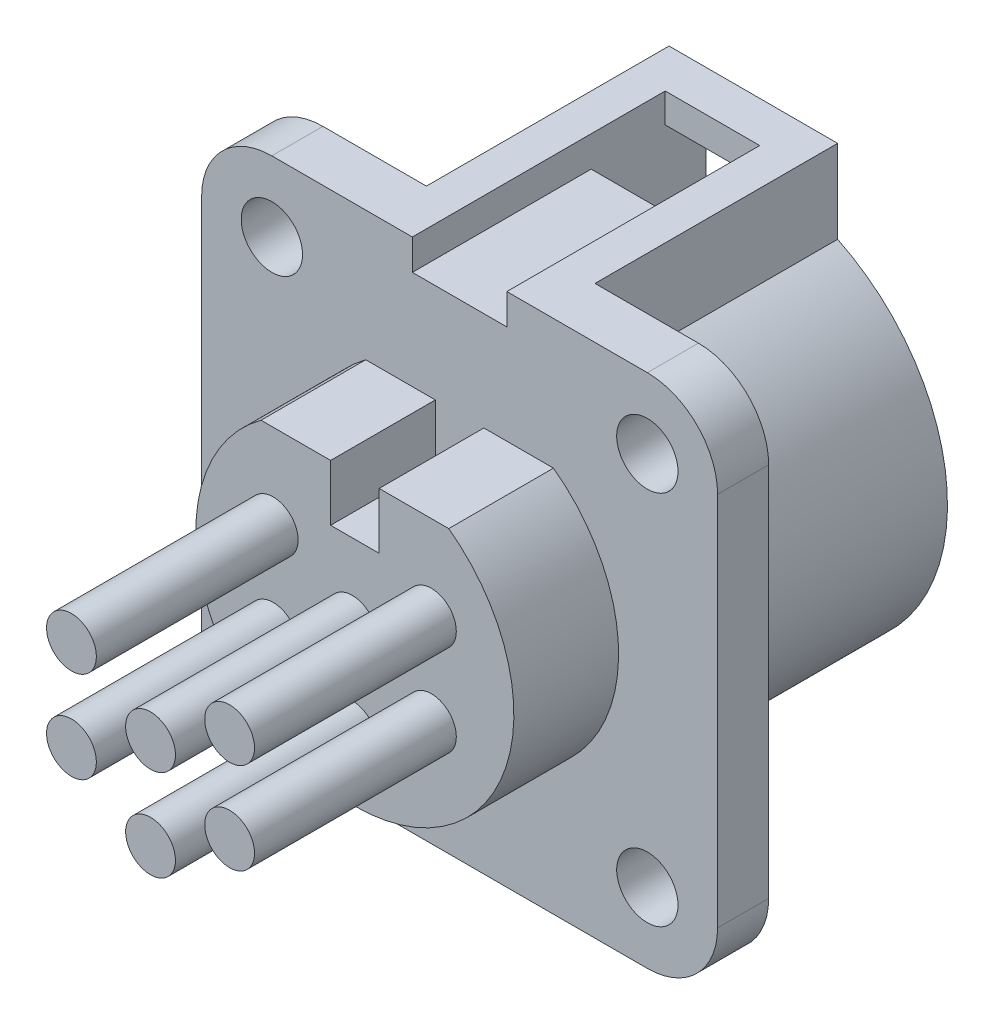
from build123d import *

# Parameters (mm, degrees)
SKICA1_W                     = 20.2
SKICA1_H                     = 20.2
P_IDAT_VYSUNUT_M1_DEPTH      = 2
F_2_4_2_4_PR_M_R_D_RY1_D     = 2.4
F_2_4_2_4_PR_M_R_D_RY1_DEPTH = 25
F_2_4_2_4_PR_M_R_D_RY1_TIP   = 0.721032743
ZAOBLIT1_R                   = 2.75
P_IDAT_VYSUNUT_M2_DEPTH      = 9.5
ODEBRAT_VYSUNUT_M1_DEPTH     = 10
SKICA7_W                     = 3.7
SKICA7_H                     = 1.7
ODEBRAT_VYSUNUT_M2_DEPTH     = 4.5
SKICA8_W                     = 3.7
SKICA8_H                     = 2.4
ODEBRAT_VYSUNUT_M3_DEPTH     = 9.9
P_IDAT_VYSUNUT_M4_DEPTH      = 4.1
P_IDAT_VYSUNUT_M3_DEPTH      = 5.55
P_IDAT_VYSUNUT_M3_DEPTH_BACK = 13.6
SKICA9_R                     = 0.725
ZAOBLIT2_R                   = 0.7
SKICA11_R                    = 0.975
P_IDAT_VYSUNUT_M5_DEPTH      = 7.9


# Read off the part's stored shape, not the designer's step: Skica-pole2
with BuildPart() as part:
    # Skica1 → Přidat vysunutím1 (new body)
    with BuildSketch(Plane.XY):
        Rectangle(SKICA1_W, SKICA1_H)
    extrude(amount=P_IDAT_VYSUNUT_M1_DEPTH)

    # Ø2.4 (2.4) průměr díry1
    with Locations(Plane.XY.offset(2)):
        with Locations((-7.35, 7.35), (7.35, 7.35), (7.35, -7.35), (-7.35, -7.35)):
            Hole(F_2_4_2_4_PR_M_R_D_RY1_D / 2, depth=F_2_4_2_4_PR_M_R_D_RY1_DEPTH)
            with Locations((0, 0, -(F_2_4_2_4_PR_M_R_D_RY1_DEPTH + F_2_4_2_4_PR_M_R_D_RY1_TIP / 2))):  # 118° drill point
                Cone(0, F_2_4_2_4_PR_M_R_D_RY1_D / 2, F_2_4_2_4_PR_M_R_D_RY1_TIP, mode=Mode.SUBTRACT)

    # Zaoblit1
    zaoblit1_edges = [part.edges().sort_by_distance(p)[0] for p in [
        (10.1, -10.1, 1),
        (-10.1, -10.1, 1),
        (-10.1, 10.1, 1),
        (10.1, 10.1, 1),
    ]]
    fillet(zaoblit1_edges, radius=ZAOBLIT1_R)

    # Skica5 → Přidat vysunutím2 (add)
    with BuildSketch(Plane(origin=(0, 0, 0), x_dir=(-1, 0, 0), z_dir=(0, 0, -1))):
        with BuildLine():
            Line((-3.3, 6.846166811), (-3.3, 0))
            Line((-3.3, 0), (3.3, 0))
            Line((3.3, 0), (3.3, 6.846166811))
            ThreePointArc((3.3, 6.846166811), (0, 7.6), (-3.3, 6.846166811))
        make_face()
        with BuildLine():
            Line((3.3, 0), (-3.3, 0))
            Line((-3.3, 0), (-3.3, 6.846166811))
            ThreePointArc((-3.3, 6.846166811), (-4.042276586, -6.435837164), (7.6, 0))
            ThreePointArc((7.6, 0), (6.435837164, 4.042276586), (3.3, 6.846166811))
            Line((3.3, 6.846166811), (3.3, 0))
        make_face()
        with BuildLine():
            Line((-3.3, 10.1), (-3.3, 6.846166811))
            ThreePointArc((-3.3, 6.846166811), (0, 7.6), (3.3, 6.846166811))
            Line((3.3, 6.846166811), (3.3, 10.1))
            Line((3.3, 10.1), (-3.3, 10.1))
        make_face()
    extrude(amount=P_IDAT_VYSUNUT_M2_DEPTH)

    # Skica6 → Odebrat vysunutím1 (cut)
    with BuildSketch(Plane(origin=(0, 0, -9.5), x_dir=(-1, 0, 0), z_dir=(0, 0, -1))):
        with BuildLine():
            Line((1.85, 5.812701609), (1.85, 4.1))
            Line((1.85, 4.1), (-1.85, 4.1))
            Line((-1.85, 4.1), (-1.85, 5.812701609))
            ThreePointArc((-1.85, 5.812701609), (-3.600347205, -4.924175058), (6.1, 0))
            ThreePointArc((6.1, 0), (4.924175058, 3.600347205), (1.85, 5.812701609))
        make_face()
        with BuildLine():
            Line((-1.85, 4.1), (1.85, 4.1))
            Line((1.85, 4.1), (1.85, 5.812701609))
            ThreePointArc((1.85, 5.812701609), (0, 6.1), (-1.85, 5.812701609))
            Line((-1.85, 5.812701609), (-1.85, 4.1))
        make_face()
        with BuildLine():
            ThreePointArc((-1.85, 5.812701609), (0, 6.1), (1.85, 5.812701609))
            Line((1.85, 5.812701609), (1.85, 8.1))
            Line((1.85, 8.1), (-1.85, 8.1))
            Line((-1.85, 8.1), (-1.85, 5.812701609))
        make_face()
    extrude(amount=-ODEBRAT_VYSUNUT_M1_DEPTH, mode=Mode.SUBTRACT)

    # Skica7 → Odebrat vysunutím2 (cut)
    with BuildSketch(Plane(origin=(0, 0, -9.5), x_dir=(-1, 0, 0), z_dir=(0, 0, -1))):
        with Locations((0, 8.1)):
            Rectangle(SKICA7_W, SKICA7_H)
    extrude(amount=-ODEBRAT_VYSUNUT_M2_DEPTH, mode=Mode.SUBTRACT)

    # Skica8 → Odebrat vysunutím3 (cut)
    with BuildSketch(Plane.XY.offset(2)):
        with Locations((0, 10.1)):
            Rectangle(SKICA8_W, SKICA8_H)
    extrude(amount=-ODEBRAT_VYSUNUT_M3_DEPTH, mode=Mode.SUBTRACT)

    # Skica10 → Přidat vysunutím4 (add)
    with BuildSketch(Plane.XY.offset(2)):
        with BuildLine():
            Line((-0.95, 5.025), (-3.674234614, 5.025))
            ThreePointArc((-3.674234614, 5.025), (-2.817668764, -5.550798838), (6.225, 0))
            ThreePointArc((6.225, 0), (5.550798838, 2.817668764), (3.674234614, 5.025))
            Line((3.674234614, 5.025), (0.95, 5.025))
            Line((0.95, 5.025), (0.95, 2.825))
            Line((0.95, 2.825), (-0.95, 2.825))
            Line((-0.95, 2.825), (-0.95, 5.025))
        make_face()
    extrude(amount=P_IDAT_VYSUNUT_M4_DEPTH)


with BuildPart() as body_2:
    # Skica9 → Přidat vysunutím3 (new, two sides: drawn at the far end of the back side and taken through both)
    with BuildSketch(Plane(origin=(0, 0, 0.5), x_dir=(-1, 0, 0), z_dir=(0, 0, -1)).offset(-P_IDAT_VYSUNUT_M3_DEPTH_BACK)):
        with Locations(Location((0, 0, 0), (0, 0, 180))):
            Circle(SKICA9_R)
    extrude(amount=P_IDAT_VYSUNUT_M3_DEPTH + P_IDAT_VYSUNUT_M3_DEPTH_BACK)

    # Zaoblit2
    zaoblit2_edges = [body_2.edges().sort_by_distance(p)[0] for p in [
        (-0.725, 0, -5.05),
    ]]
    fillet(zaoblit2_edges, radius=ZAOBLIT2_R)

    # Skica11 → Přidat vysunutím5 (add)
    with BuildSketch(Plane.XY.offset(14.1)):
        Circle(SKICA11_R)
    extrude(amount=-P_IDAT_VYSUNUT_M5_DEPTH)


with BuildPart() as body_3:
    # Skica-pole2 outline → Skica-pole2 (revolve)
    with BuildSketch(Plane(origin=(3.096040819, 1.7875, 0), x_dir=(1, 0, 0), z_dir=(0, -1, 0))):
        with BuildLine():
            ThreePointArc((0.025, -5.05), (0.519974747, -4.844974747), (0.725, -4.35))
            Line((0.725, -4.35), (0.725, 6.2))
            Line((0.725, 6.2), (0.975, 6.2))
            Line((0.975, 6.2), (0.975, 14.1))
            Line((0.975, 14.1), (0, 14.1))
            Line((0, 14.1), (0, -5.05))
            Line((0, -5.05), (0.025, -5.05))
        make_face()
    revolve(axis=Axis((3.096040819, 1.7875, 0), (0, 0, 1)))


with BuildPart() as body_4:
    # Skica-pole2 2 outline → Skica-pole2 2 (revolve)
    with BuildSketch(Plane(origin=(3.096040819, -1.7875, 0), x_dir=(1, 0, 0), z_dir=(0, -1, 0))):
        with BuildLine():
            Line((0, 14.1), (0, -5.05))
            Line((0, -5.05), (0.025, -5.05))
            ThreePointArc((0.025, -5.05), (0.519974747, -4.844974747), (0.725, -4.35))
            Line((0.725, -4.35), (0.725, 6.2))
            Line((0.725, 6.2), (0.975, 6.2))
            Line((0.975, 6.2), (0.975, 14.1))
            Line((0.975, 14.1), (0, 14.1))
        make_face()
    revolve(axis=Axis((3.096040819, -1.7875, 0), (0, 0, 1)))


with BuildPart() as body_5:
    # Skica-pole2 3 outline → Skica-pole2 3 (revolve)
    with BuildSketch(Plane.XZ.offset(3.575)):
        with BuildLine():
            Line((0, 14.1), (0, -5.05))
            Line((0, -5.05), (0.025, -5.05))
            ThreePointArc((0.025, -5.05), (0.519974747, -4.844974747), (0.725, -4.35))
            Line((0.725, -4.35), (0.725, 6.2))
            Line((0.725, 6.2), (0.975, 6.2))
            Line((0.975, 6.2), (0.975, 14.1))
            Line((0.975, 14.1), (0, 14.1))
        make_face()
    revolve(axis=Axis((0, -3.575, 0), (0, 0, 1)))


with BuildPart() as body_6:
    # Skica-pole2 4 outline → Skica-pole2 4 (revolve)
    with BuildSketch(Plane(origin=(-3.096040819, -1.7875, 0), x_dir=(1, 0, 0), z_dir=(0, -1, 0))):
        with BuildLine():
            Line((0, 14.1), (0, -5.05))
            Line((0, -5.05), (0.025, -5.05))
            ThreePointArc((0.025, -5.05), (0.519974747, -4.844974747), (0.725, -4.35))
            Line((0.725, -4.35), (0.725, 6.2))
            Line((0.725, 6.2), (0.975, 6.2))
            Line((0.975, 6.2), (0.975, 14.1))
            Line((0.975, 14.1), (0, 14.1))
        make_face()
    revolve(axis=Axis((-3.096040819, -1.7875, 0), (0, 0, 1)))


with BuildPart() as body_7:
    # Skica-pole2 5 outline → Skica-pole2 5 (revolve)
    with BuildSketch(Plane(origin=(-3.096040819, 1.7875, 0), x_dir=(1, 0, 0), z_dir=(0, -1, 0))):
        with BuildLine():
            Line((0, 14.1), (0, -5.05))
            Line((0, -5.05), (0.025, -5.05))
            ThreePointArc((0.025, -5.05), (0.519974747, -4.844974747), (0.725, -4.35))
            Line((0.725, -4.35), (0.725, 6.2))
            Line((0.725, 6.2), (0.975, 6.2))
            Line((0.975, 6.2), (0.975, 14.1))
            Line((0.975, 14.1), (0, 14.1))
        make_face()
    revolve(axis=Axis((-3.096040819, 1.7875, 0), (0, 0, 1)))


solid = Compound([part.part, body_2.part, body_3.part, body_4.part, body_5.part, body_6.part, body_7.part])
